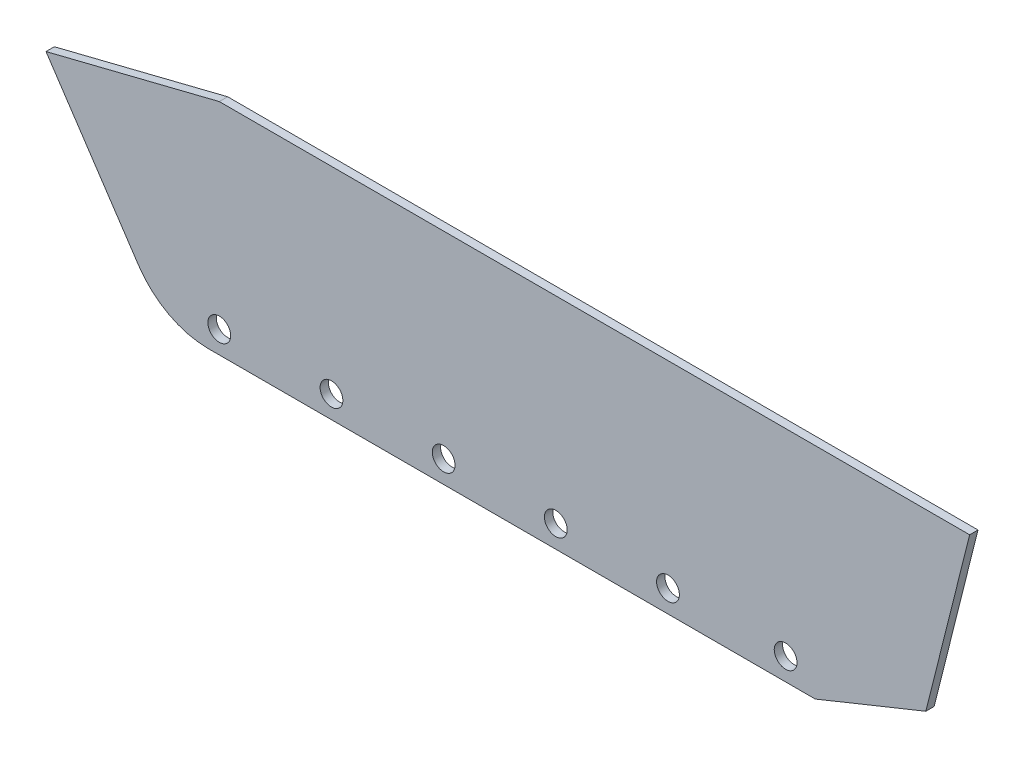
from build123d import *

# Parameters (mm, degrees)
BOSS_EXTRUDE1_DEPTH = 4.7625
SKETCH1_4_R         = 6.5
CUT_EXTRUDE1_DEPTH  = 439.920211962
FILLET4_R           = 48
CUT_EXTRUDE3_DEPTH  = 10


with BuildPart() as part:
    # Sketch1 → Boss-Extrude1 (new body)
    with BuildSketch(Plane.XY):
        Polygon((428.120588235, 28.570833333), (0, 28.570833333), (-98.879411765, 3.850980392), (-31.879411765, -96.649019608), (366, -96.649019608), (403.120588235, -71.149019608), align=None)
    extrude(amount=BOSS_EXTRUDE1_DEPTH)

    # Sketch1<4> → Cut-Extrude1 (cut, through all)
    with BuildSketch(Plane.XY):
        with Locations((0, -83.899019608)):
            Circle(SKETCH1_4_R)
        with Locations((64, -83.899019608)):
            Circle(SKETCH1_4_R)
        with Locations((128, -83.899019608)):
            Circle(SKETCH1_4_R)
        with Locations((192, -83.899019608)):
            Circle(SKETCH1_4_R)
        with Locations((256, -83.899019608)):
            Circle(SKETCH1_4_R)
        with Locations((323.120588235, -83.899019608)):
            Circle(SKETCH1_4_R)
    extrude(amount=CUT_EXTRUDE1_DEPTH, mode=Mode.SUBTRACT)

    # Fillet4
    fillet4_edges = [part.edges().sort_by_distance(p)[0] for p in [
        (-31.879411765, -96.649019608, 2.38125),
    ]]
    fillet(fillet4_edges, radius=FILLET4_R)

    # Sketch7 → Cut-Extrude3 (cut)
    with BuildSketch(Plane.XY.offset(4.7625)):
        Polygon((403.120588235, -71.149019608), (340.005873473, -96.649019608), (366, -96.649019608), align=None)
    extrude(amount=-CUT_EXTRUDE3_DEPTH, mode=Mode.SUBTRACT)


solid = part.part
